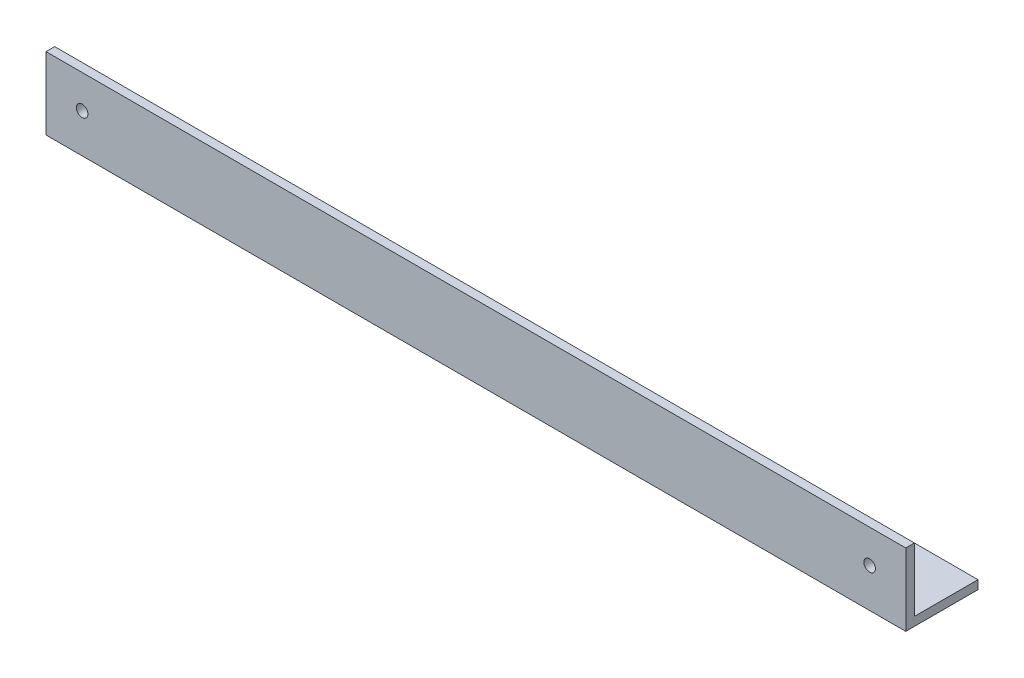
from build123d import *

# Parameters (mm, degrees)
EXTRUDE_2_DEPTH     = 595
SKETCH_2_R          = 4
CUT_EXTRUDE_1_DEPTH = 600.186949124


with BuildPart() as part:
    # Эскиз1 → Вытянуть-Тонкостенный2 (new body)
    with BuildSketch(Plane(origin=(0, 0, 0), x_dir=(0, 0, -1), z_dir=(1, 0, 0))):
        Polygon((0, 50), (0, 0), (50, 0), (50, 6), (6, 6), (6, 50), align=None)
    extrude(amount=EXTRUDE_2_DEPTH)

    # Эскиз2 → Вырез-Вытянуть1 (cut, through all)
    with BuildSketch(Plane.XY):
        with Locations((25, 27)):
            Circle(SKETCH_2_R)
        with Locations((570, 27)):
            Circle(SKETCH_2_R)
    extrude(amount=-CUT_EXTRUDE_1_DEPTH, mode=Mode.SUBTRACT)


solid = part.part
